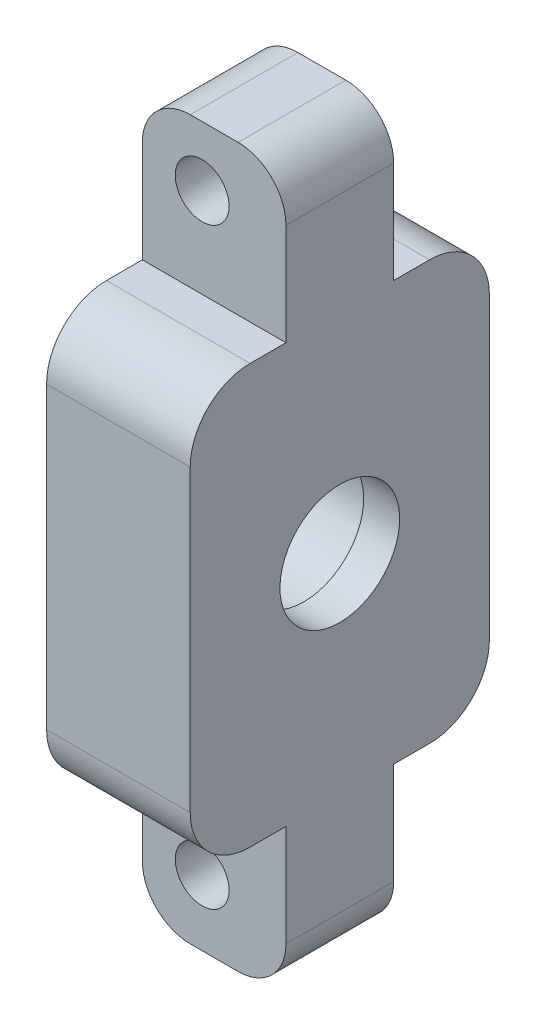
from build123d import *

# Parameters (mm, degrees)
SKETCH2_W           = 12
SKETCH2_H           = 60
BOSS_EXTRUDE1_DEPTH = 12.5
SKETCH3_W           = 8
SKETCH3_H           = 12.5
CUT_EXTRUDE1_DEPTH  = 35.644624403
SKETCH4_R           = 2.25
CUT_EXTRUDE2_DEPTH  = 36
FILLET1_R           = 5
FILLET2_R           = 4
CUT_EXTRUDE3_START  = -8
SKETCH5_R           = 5
CUT_EXTRUDE3_DEPTH  = 4
SKETCH6_R           = 7.5
CUT_EXTRUDE4_DEPTH  = 4
SKETCH8_R           = 5.5
CUT_EXTRUDE6_DEPTH  = 5


with BuildPart() as part:
    # Sketch2 → Boss-Extrude1 (new, symmetric)
    with BuildSketch(Plane.XY):
        Rectangle(SKETCH2_W, SKETCH2_H)
    extrude(amount=BOSS_EXTRUDE1_DEPTH, both=True)

    # Sketch3 → Cut-Extrude1 (cut, through all)
    with BuildSketch(Plane(origin=(6, 0, 0), x_dir=(0, 0, -1), z_dir=(1, 0, 0))):
        with Locations((-8.5, 23.75)):
            Rectangle(SKETCH3_W, SKETCH3_H)
        with Locations((8.5, 23.75)):
            Rectangle(SKETCH3_W, SKETCH3_H)
        with Locations((-8.5, -23.75)):
            Rectangle(SKETCH3_W, SKETCH3_H)
        with Locations((8.5, -23.75)):
            Rectangle(SKETCH3_W, SKETCH3_H)
    extrude(amount=-CUT_EXTRUDE1_DEPTH, mode=Mode.SUBTRACT)

    # Sketch4 → Cut-Extrude2 (cut, through all)
    with BuildSketch(Plane.XY.offset(4.5)):
        with Locations((-1, 25)):
            Circle(SKETCH4_R)
        with Locations((-1, -24.5)):
            Circle(SKETCH4_R)
    extrude(amount=-CUT_EXTRUDE2_DEPTH, mode=Mode.SUBTRACT)

    # Fillet1
    fillet1_edges = [part.edges().sort_by_distance(p)[0] for p in [
        (0, -17.5, 12.5),
        (0, -17.5, -12.5),
        (0, 17.5, -12.5),
        (0, 17.5, 12.5),
    ]]
    fillet(fillet1_edges, radius=FILLET1_R)

    # Fillet2
    fillet2_edges = [part.edges().sort_by_distance(p)[0] for p in [
        (6, -30, 0),
        (-6, -30, 0),
        (-6, 30, 0),
        (6, 30, 0),
    ]]
    fillet(fillet2_edges, radius=FILLET2_R)

    # Sketch5 → Cut-Extrude3 (cut)
    with BuildSketch(Plane.ZY.offset(6).offset(CUT_EXTRUDE3_START)):
        Circle(SKETCH5_R)
    extrude(amount=-CUT_EXTRUDE3_DEPTH, mode=Mode.SUBTRACT)

    # Sketch6 → Cut-Extrude4 (cut)
    with BuildSketch(Plane.ZY.offset(6)):
        Circle(SKETCH6_R)
    extrude(amount=-CUT_EXTRUDE4_DEPTH, mode=Mode.SUBTRACT)

    # Sketch8 → Cut-Extrude6 (cut)
    with BuildSketch(Plane.ZY.offset(2)):
        Circle(SKETCH8_R)
    extrude(amount=-CUT_EXTRUDE6_DEPTH, mode=Mode.SUBTRACT)


solid = part.part
